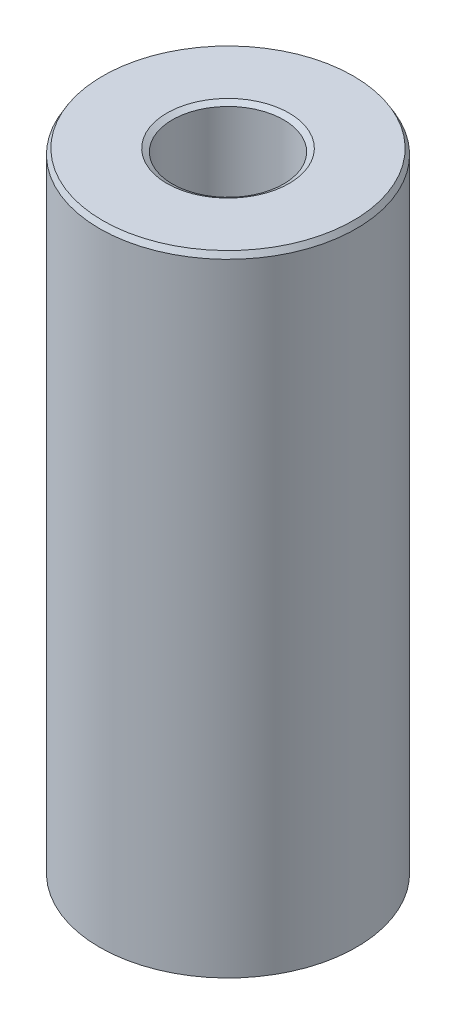
from build123d import *
from OCP.BRepFilletAPI import BRepFilletAPI_MakeChamfer

# Parameters (mm, degrees)
SKETCH1_R           = 45
BOSS_EXTRUDE1_DEPTH = 221.109307599
SKETCH2_R           = 19.502987113
CUT_EXTRUDE1_DEPTH  = 231.085475219
CHAMFER1_SIZE       = 1.899842069
CHAMFER1_SIZE2      = 1.09687433


with BuildPart() as part:
    # Sketch1 → Boss-Extrude1 (new body)
    with BuildSketch(Plane(origin=(0, 0, 0), x_dir=(1, 0, 0), z_dir=(0, 1, 0))):
        Circle(SKETCH1_R)
    extrude(amount=BOSS_EXTRUDE1_DEPTH)

    # Sketch2 → Cut-Extrude1 (cut, through all)
    with BuildSketch(Plane(origin=(0, 0, 0), x_dir=(1, 0, 0), z_dir=(0, 1, 0))):
        Circle(SKETCH2_R)
    extrude(amount=CUT_EXTRUDE1_DEPTH, mode=Mode.SUBTRACT)

    # Chamfer1: one chamfer whose edges measure the first distance from different faces: ONE call of the kernel's chamfer builder (chamfer() names one face for all edges)
    chamfer1_edges_1 = [part.edges().sort_by_distance(p)[0] for p in [
        (-19.502987113, 221.109307599, 0),
    ]]
    chamfer1_side_1 = [part.faces().sort_by_distance(p)[0] for p in [
        (-43.727207794, 221.109307599, 0),
    ]]
    chamfer1_edges_2 = [part.edges().sort_by_distance(p)[0] for p in [
        (-19.502987113, 0, 0),
    ]]
    chamfer1_side_2 = [part.faces().sort_by_distance(p)[0] for p in [
        (-19.502987113, 110.554653799, 0),
    ]]
    chamfer1_edges_3 = [part.edges().sort_by_distance(p)[0] for p in [
        (-45, 0, 0),
    ]]
    chamfer1_side_3 = [part.faces().sort_by_distance(p)[0] for p in [
        (-43.727207794, 0, 0),
    ]]
    chamfer1_edges_4 = [part.edges().sort_by_distance(p)[0] for p in [
        (-45, 221.109307599, 0),
    ]]
    chamfer1_side_4 = [part.faces().sort_by_distance(p)[0] for p in [
        (-45, 110.554653799, 0),
    ]]
    chamfer1 = BRepFilletAPI_MakeChamfer(part.part.solid().wrapped)
    for e in chamfer1_edges_1:
        chamfer1.Add(CHAMFER1_SIZE, CHAMFER1_SIZE2, e.wrapped, chamfer1_side_1[0].wrapped)  # the first distance lies on this face
    for e in chamfer1_edges_2:
        chamfer1.Add(CHAMFER1_SIZE, CHAMFER1_SIZE2, e.wrapped, chamfer1_side_2[0].wrapped)  # the first distance lies on this face
    for e in chamfer1_edges_3:
        chamfer1.Add(CHAMFER1_SIZE, CHAMFER1_SIZE2, e.wrapped, chamfer1_side_3[0].wrapped)  # the first distance lies on this face
    for e in chamfer1_edges_4:
        chamfer1.Add(CHAMFER1_SIZE, CHAMFER1_SIZE2, e.wrapped, chamfer1_side_4[0].wrapped)  # the first distance lies on this face
    add(Compound.cast(chamfer1.Shape()), mode=Mode.REPLACE)


solid = part.part
